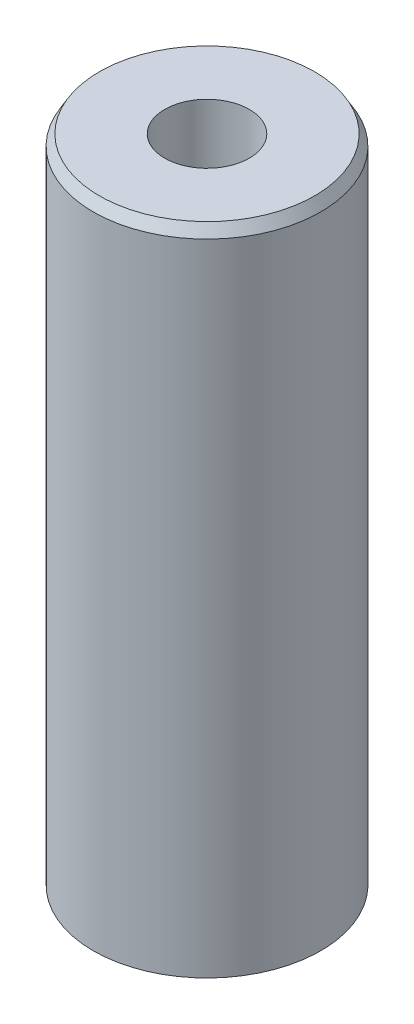
from build123d import *
from OCP.BRepFilletAPI import BRepFilletAPI_MakeChamfer

# Parameters (mm, degrees)
SKETCH1_R           = 35
BOSS_EXTRUDE1_DEPTH = 202.016611042
SKETCH2_R           = 13.00930201
CUT_EXTRUDE1_DEPTH  = 208.992093929
CHAMFER1_SIZE       = 3.311427511
CHAMFER1_SIZE2      = 1.911853565


with BuildPart() as part:
    # Sketch1 → Boss-Extrude1 (new body)
    with BuildSketch(Plane(origin=(0, 0, 0), x_dir=(1, 0, 0), z_dir=(0, 1, 0))):
        Circle(SKETCH1_R)
    extrude(amount=BOSS_EXTRUDE1_DEPTH)

    # Sketch2 → Cut-Extrude1 (cut, through all)
    with BuildSketch(Plane(origin=(0, 0, 0), x_dir=(1, 0, 0), z_dir=(0, 1, 0))):
        Circle(SKETCH2_R)
    extrude(amount=CUT_EXTRUDE1_DEPTH, mode=Mode.SUBTRACT)

    # Chamfer1: one chamfer whose edges measure the first distance from different faces: ONE call of the kernel's chamfer builder (chamfer() names one face for all edges)
    chamfer1_edges_1 = [part.edges().sort_by_distance(p)[0] for p in [
        (-35, 202.016611042, 0),
    ]]
    chamfer1_side_1 = [part.faces().sort_by_distance(p)[0] for p in [
        (-35, 101.008305521, 0),
    ]]
    chamfer1_edges_2 = [part.edges().sort_by_distance(p)[0] for p in [
        (-35, 0, 0),
    ]]
    chamfer1_side_2 = [part.faces().sort_by_distance(p)[0] for p in [
        (-34.010050506, 0, 0),
    ]]
    chamfer1 = BRepFilletAPI_MakeChamfer(part.part.solid().wrapped)
    for e in chamfer1_edges_1:
        chamfer1.Add(CHAMFER1_SIZE, CHAMFER1_SIZE2, e.wrapped, chamfer1_side_1[0].wrapped)  # the first distance lies on this face
    for e in chamfer1_edges_2:
        chamfer1.Add(CHAMFER1_SIZE, CHAMFER1_SIZE2, e.wrapped, chamfer1_side_2[0].wrapped)  # the first distance lies on this face
    add(Compound.cast(chamfer1.Shape()), mode=Mode.REPLACE)


solid = part.part
